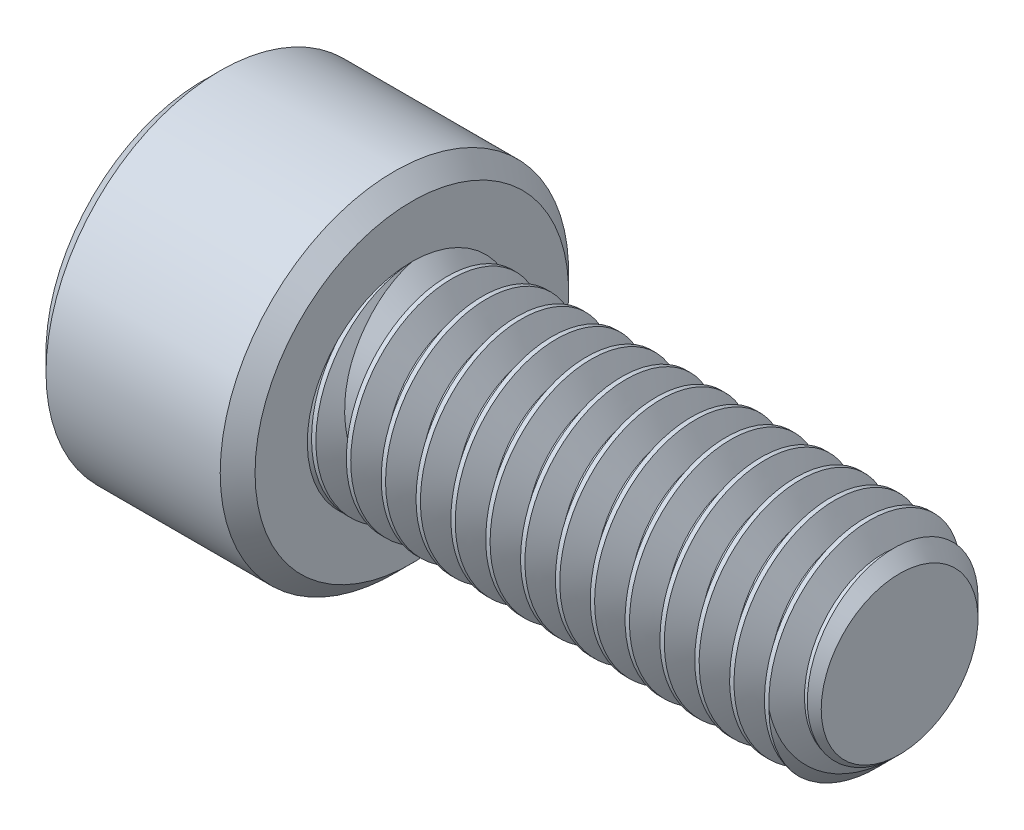
from build123d import *

# Parameters (mm, degrees)
CUT_EXTRUDE1_DEPTH = 4.5
CHAMFER1_SIZE      = 0.5
CHAMFER2_SIZE      = 0.75
CUT_SWEEP1_PITCH   = 1
CUT_SWEEP1_TO      = 14


with BuildPart() as part:
    # Sketch3 → Revolve1 (revolve)
    with BuildSketch(Plane.XY, mode=Mode.PRIVATE) as revolve1_sk:
        Polygon((-10, 5), (-10, 0), (10, 0), (10, 3), (-4, 3), (-4, 5), align=None)
    revolve(revolve1_sk.sketch.rotate(Axis((-10, 0, 0), (1, 0, 0)), 90), axis=Axis((-10, 0, 0), (1, 0, 0)))

    # Sketch4 → Cut-Extrude1 (cut)
    with BuildSketch(Plane.ZY.offset(10)):
        Polygon((-2.5, -1.443375673), (-2.5, 1.443375673), (0, 2.886751346), (2.5, 1.443375673), (2.5, -1.443375673), (0, -2.886751346), align=None)
    extrude(amount=-CUT_EXTRUDE1_DEPTH, mode=Mode.SUBTRACT)

    # Chamfer1
    chamfer1_edges = [part.edges().sort_by_distance(p)[0] for p in [
        (-4, 0, -5),
        (-10, 0, -5),
    ]]
    chamfer(chamfer1_edges, length=CHAMFER1_SIZE)

    # Chamfer2
    chamfer2_edges = [part.edges().sort_by_distance(p)[0] for p in [
        (10, 0, -3),
    ]]
    chamfer(chamfer2_edges, length=CHAMFER2_SIZE)

    # Cut-Extrude2 cone 1 section (through the dimple's axis) → Cut-Extrude2 (revolve, cut)
    with BuildSketch(Plane(origin=(-10, 0, 0), x_dir=(0, 0, 1), z_dir=(0, 1, 0))):
        Polygon((0, 0), (2.886751346, 0), (0, 2.886751346), align=None)
    revolve(axis=Axis((-10, 0, 0), (1, 0, 0)), mode=Mode.SUBTRACT)


with BuildPart() as body_2:
    # Split1: read off the stored shape, not the designer's step
    # Split1: the piece on the far side of the plane
    add(part.part)
    split(bisect_by=Plane.YZ.offset(-4), keep=Keep.BOTTOM)


with BuildPart() as part_1:
    add(part.part)

    # Split1
    split(bisect_by=Plane.YZ.offset(-4), keep=Keep.TOP)

    # Cut-Sweep1: arcs per turn and ends read off the stored shape
    # Cut-Sweep1: the profile of Sketch7 screwed along a right-hand helix through 15 turns, 8 arcs to a turn; built about Z, then put on its axis
    cut_sweep1_z = Axis((0, 0, 0), (0, 0, 1))
    cut_sweep1_corners = [(2.350480947, 0, -0.375), (2.350480947, 0, -0.5), (3.054126588, 0, -0.90625), (3.054126588, 0, 0.03125)]
    with BuildLine(mode=Mode.PRIVATE) as cut_sweep1_profile:
        Line(cut_sweep1_corners[0], cut_sweep1_corners[1])
        Line(cut_sweep1_corners[1], cut_sweep1_corners[2])
        Line(cut_sweep1_corners[2], cut_sweep1_corners[3])
        Line(cut_sweep1_corners[3], cut_sweep1_corners[0])
    cut_sweep1_cap = Face(cut_sweep1_profile.wire())
    cut_sweep1_turn_angles = [0, 22.5, 45, 67.5, 90, 112.5, 135, 157.5, 180, 202.5, 225, 247.5, 270, 292.5, 315, 337.5, 360]
    cut_sweep1_turn_weights = [1, 0.9238795325112867, 1, 0.9238795325112867, 1, 0.9238795325112867, 1, 0.9238795325112867, 1, 0.9238795325112867, 1, 0.9238795325112867, 1, 0.9238795325112867, 1, 0.9238795325112867, 1]
    cut_sweep1_turn_rails = [Edge.make_bspline([Vector(p[0], p[1], 0).rotate(cut_sweep1_z, cut_sweep1_turn_angles[k]) / cut_sweep1_turn_weights[k] + Vector(0, 0, p[2] + CUT_SWEEP1_PITCH * cut_sweep1_turn_angles[k] / 360) for k in range(17)], [0, 0, 0, 1, 1, 2, 2, 3, 3, 4, 4, 5, 5, 6, 6, 7, 7, 8, 8, 8], 2, cut_sweep1_turn_weights) for p in cut_sweep1_corners]
    cut_sweep1_turn_sides = [Face.make_surface_from_curves(cut_sweep1_turn_rails[p[0]], cut_sweep1_turn_rails[p[1]]) for p in [(0, 1), (1, 2), (2, 3), (3, 0)]]
    cut_sweep1 = Plane(origin=(10, 0, 0), x_dir=(0, 1, 0), z_dir=(-1, 0, 0)) * split(Solid(Shell([*[p.moved(Location((0, 0, CUT_SWEEP1_PITCH * i))) for i in range(15) for p in cut_sweep1_turn_sides], cut_sweep1_cap, cut_sweep1_cap.rotate(cut_sweep1_z, 5400).moved(Location((0, 0, CUT_SWEEP1_PITCH * 5400 / 360)))])), bisect_by=Plane.XY.offset(CUT_SWEEP1_TO), keep=Keep.BOTTOM, mode=Mode.PRIVATE)
    add(cut_sweep1, mode=Mode.SUBTRACT)

    add(body_2.part)  # Boss-Extrude1 merges body 2
    # Boss-Extrude1: read off the stored shape, not the designer's step
    # Boss-Extrude1 outline → Boss-Extrude1 (revolve)
    with BuildSketch(Plane.YX):
        Polygon((3, -4), (2.350476219, -3.350476219), (2.350476219, -4), align=None)
    revolve(axis=Axis((0, 0, 0), (1, 0, 0)))


solid = part_1.part
